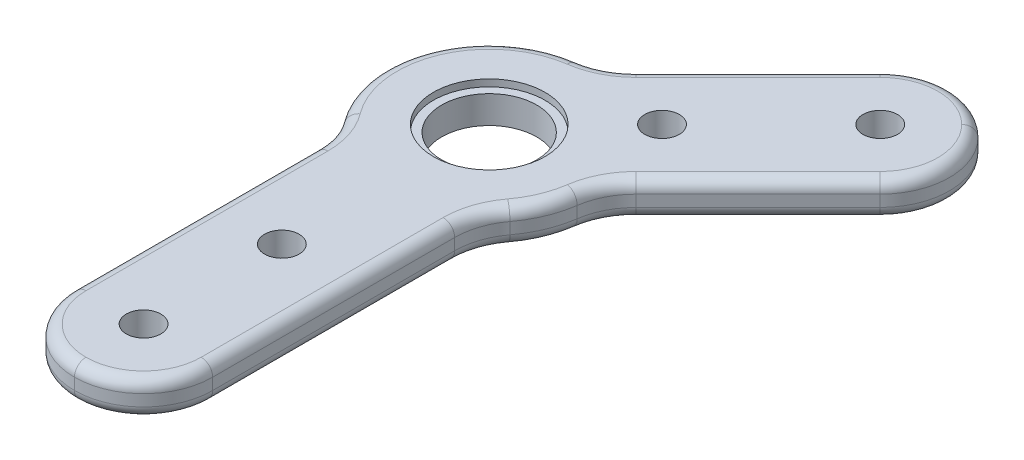
from build123d import *

# Parameters (mm, degrees)
SKETCH1_R           = 3.175
SKETCH1_R_2         = 8.73125
BOSS_EXTRUDE1_DEPTH = 6.35
FILLET2_R           = 12.7
FILLET3_R           = 2.116666667
SKETCH2_R           = 10.2489
CUT_EXTRUDE1_DEPTH  = 1.27


with BuildPart() as part:
    # Sketch1 → Boss-Extrude1 (new body)
    with BuildSketch(Plane(origin=(0, 0, 0), x_dir=(1, 0, 0), z_dir=(0, 1, 0))):
        with BuildLine():
            Line((-12.7, 17.550968343), (-12.7, -44.45))
            Line((-12.7, -44.45), (12.7, -44.45))
            Line((12.7, -44.45), (12.7, 17.550968343))
            ThreePointArc((12.7, 17.550968343), (17.599905094, 24.459880613), (19.020487692, 32.80997545))
            Line((19.020487692, 32.80997545), (53.881536726, 67.671024484))
            Line((53.881536726, 67.671024484), (35.921024484, 85.631536726))
            Line((35.921024484, 85.631536726), (1.05997545, 50.770487692))
            ThreePointArc((1.05997545, 50.770487692), (-17.599905094, 39.040119387), (-12.7, 17.550968343))
        make_face()
        with Locations(Location((0, -31.75, 0), (0, 0, 270))):
            Circle(SKETCH1_R, mode=Mode.SUBTRACT)
        with Locations(Location((0, -6.35, 0), (0, 0, 270))):
            Circle(SKETCH1_R, mode=Mode.SUBTRACT)
        with Locations(Location((0, 31.75, 0), (0, 0, 270))):
            Circle(SKETCH1_R_2, mode=Mode.SUBTRACT)
        with Locations(Location((35.921024484, 67.671024484, 0), (0, 0, 270))):
            Circle(SKETCH1_R, mode=Mode.SUBTRACT)
        with Locations(Location((15.875, 47.625, 0), (0, 0, 270))):
            Circle(SKETCH1_R, mode=Mode.SUBTRACT)
    extrude(amount=BOSS_EXTRUDE1_DEPTH)

    # Fillet2
    fillet2_edges = [part.edges().sort_by_distance(p)[0] for p in [
        (35.921024484, 3.175, -85.631536726),
        (53.881536726, 3.175, -67.671024484),
        (-12.7, 3.175, 44.45),
        (12.7, 3.175, 44.45),
        (1.05997545, 3.175, -50.770487692),
        (-12.7, 3.175, -17.550968343),
        (12.7, 3.175, -17.550968343),
        (19.020487692, 3.175, -32.80997545),
    ]]
    fillet(fillet2_edges, radius=FILLET2_R - 0.0001)  # a hair under: the kernel refuses the full size

    # Fillet3
    fillet3_edges = [part.edges().sort_by_distance(p)[0] for p in [
        (17.599905094, 0, -24.459880613),
        (17.599905094, 6.35, -24.459880613),
        (12.7, 0, 9.525033333),
        (12.7, 6.35, 9.525033333),
        (33.675984024, 0, -47.465471782),
        (33.675984024, 6.35, -47.465471782),
        (-17.599905094, 0, -39.040119387),
        (-17.599905094, 6.35, -39.040119387),
        (15.715471782, 0, -65.425984024),
        (15.715471782, 6.35, -65.425984024),
        (-12.7, 0, 9.525033333),
        (-12.7, 6.35, 9.525033333),
        (8.98028541, 0, 40.73028541),
        (-8.98028541, 0, 40.73028541),
        (48.621065906, 0, -67.671024484),
        (35.921024484, 0, -80.371065906),
        (8.98028541, 6.35, 40.73028541),
        (-8.98028541, 6.35, 40.73028541),
        (48.621065906, 6.35, -67.671024484),
        (35.921024484, 6.35, -80.371065906),
        (13.351719091, 0, -16.716100664),
        (13.351719091, 6.35, -16.716100664),
        (20.071663278, 0, -32.939481059),
        (20.071663278, 6.35, -32.939481059),
        (1.189481059, 0, -51.821663278),
        (1.189481059, 6.35, -51.821663278),
        (-13.351719091, 0, -16.716100664),
        (-13.351719091, 6.35, -16.716100664),
    ]]
    fillet(fillet3_edges, radius=FILLET3_R)

    # Sketch2 → Cut-Extrude1 (cut)
    with BuildSketch(Plane(origin=(0, 6.35, 0), x_dir=(1, 0, 0), z_dir=(0, 1, 0))):
        with Locations(Location((0, 31.75, 0), (0, 0, 270))):
            Circle(SKETCH2_R)
    extrude(amount=-CUT_EXTRUDE1_DEPTH, mode=Mode.SUBTRACT)


solid = part.part
